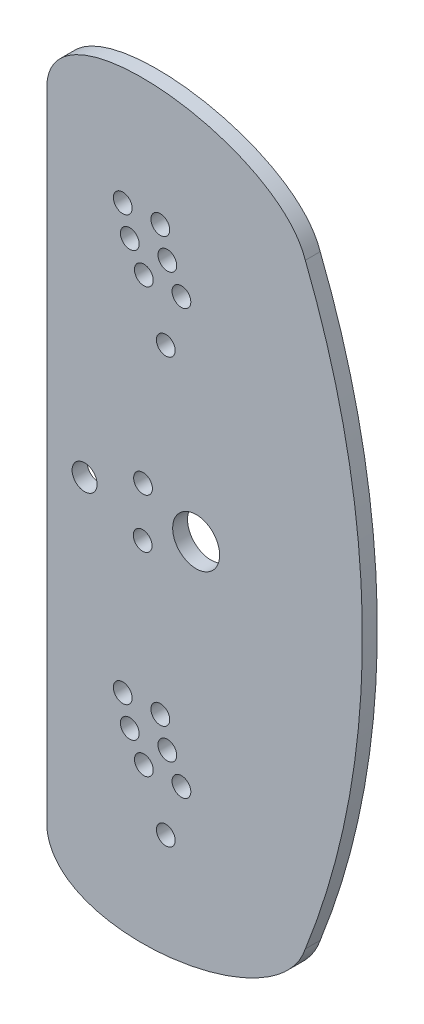
from build123d import *

# Parameters (mm, degrees)
SKETCH2_R           = 12.0000014
SKETCH2_R_2         = 15.99946
SKETCH2_R_3         = 29.99994
BOSS_EXTRUDE3_DEPTH = 19.05


with BuildPart() as part:
    # Sketch2 → Boss-Extrude3 (new body)
    with BuildSketch(Plane.XY):
        with BuildLine():
            add(Edge.make_bspline(
                [(1691.296561672, 1789.049084222), (1656.762851887, 1894.057259265), (1371.325091688, 1929.801340936), (1361.096561672, 1819.73467427)],
                knots=[0, 0, 0, 0, 7.638294788, 7.638294788, 7.638294788, 7.638294788], degree=3))
            Line((1361.096561672, 1819.73467427), (1361.096561672, 1789.049084222))
            Line((1361.096561672, 1789.049084222), (1361.096561672, 1027.049084222))
            Line((1361.096561672, 1027.049084222), (1361.096561672, 996.363494174))
            add(Edge.make_bspline(
                [(1691.296561672, 1027.049084222), (1656.707719979, 922.059056278), (1371.325091688, 886.296827508), (1361.096561672, 996.363494174)],
                knots=[0, 0, 0, 0, 7.629784399, 7.629784399, 7.629784399, 7.629784399], degree=3))
            ThreePointArc((1691.296561672, 1027.049084222), (1764.258141615, 1408.049084222), (1691.296561672, 1789.049084222))
        make_face()
        with Locations((1485.04883119, 1127.769752719)):
            Circle(SKETCH2_R, mode=Mode.SUBTRACT)
        with Locations((1513.04824179, 1064.019689719)):
            Circle(SKETCH2_R, mode=Mode.SUBTRACT)
        with Locations((1533.04876059, 1127.769752719)):
            Circle(SKETCH2_R, mode=Mode.SUBTRACT)
        with Locations((1458.04883439, 1194.019683719)):
            Circle(SKETCH2_R, mode=Mode.SUBTRACT)
        with Locations((1409.336846603, 1408.026574973)):
            Circle(SKETCH2_R_2, mode=Mode.SUBTRACT)
        with Locations((1467.04884179, 1159.019753719)):
            Circle(SKETCH2_R, mode=Mode.SUBTRACT)
        with Locations((1506.04876379, 1194.019683719)):
            Circle(SKETCH2_R, mode=Mode.SUBTRACT)
        with Locations((1515.04877119, 1159.019753719)):
            Circle(SKETCH2_R, mode=Mode.SUBTRACT)
        with Locations((1483.508385502, 1375.196746661)):
            Circle(SKETCH2_R, mode=Mode.SUBTRACT)
        with Locations((1551.839209014, 1408.026574973)):
            Circle(SKETCH2_R_3, mode=Mode.SUBTRACT)
        with Locations((1483.982713285, 1438.691719032)):
            Circle(SKETCH2_R, mode=Mode.SUBTRACT)
        with Locations((1513.04824179, 1605.989897878)):
            Circle(SKETCH2_R, mode=Mode.SUBTRACT)
        with Locations((1458.04883439, 1735.989891878)):
            Circle(SKETCH2_R, mode=Mode.SUBTRACT)
        with Locations((1467.04884179, 1700.989961878)):
            Circle(SKETCH2_R, mode=Mode.SUBTRACT)
        with Locations((1485.04883119, 1669.739960878)):
            Circle(SKETCH2_R, mode=Mode.SUBTRACT)
        with Locations((1506.04876379, 1735.989891878)):
            Circle(SKETCH2_R, mode=Mode.SUBTRACT)
        with Locations((1515.04877119, 1700.989961878)):
            Circle(SKETCH2_R, mode=Mode.SUBTRACT)
        with Locations((1533.04876059, 1669.739960878)):
            Circle(SKETCH2_R, mode=Mode.SUBTRACT)
    extrude(amount=BOSS_EXTRUDE3_DEPTH)


solid = part.part
